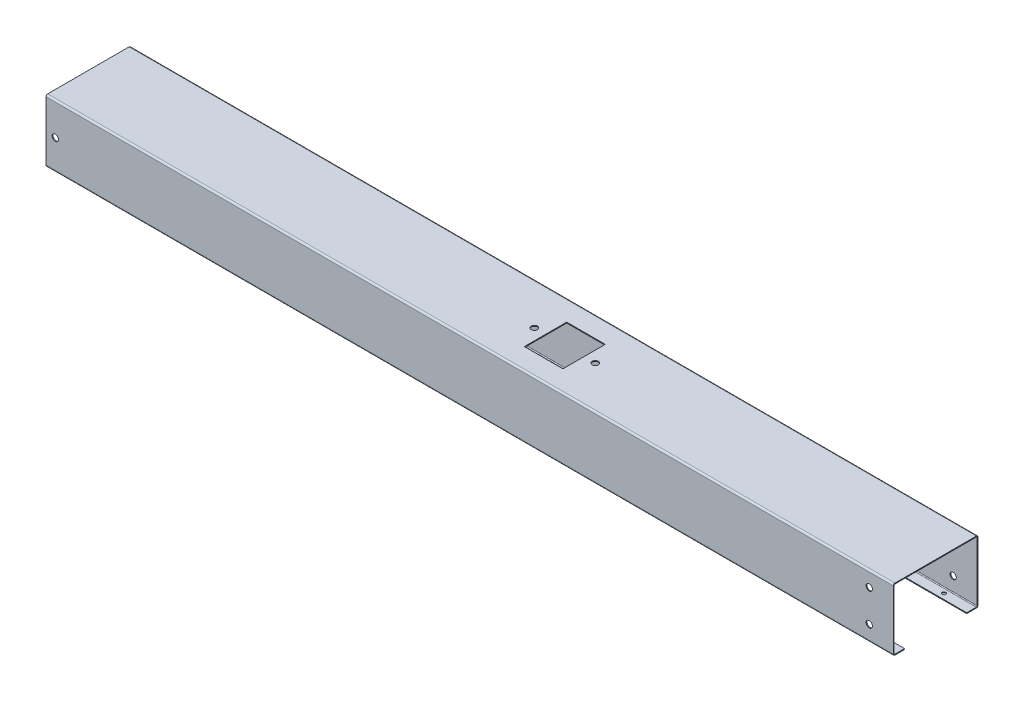
from build123d import *

# Parameters (mm, degrees)
SKETCH1_W                      = 762
SKETCH1_H                      = 76.2
BASE_FLANGE1_DEPTH             = 0.75946
CUT_EXTRUDE1_DEPTH             = 10
SKETCH7_R                      = 2.8194
CUT_EXTRUDE2_DEPTH             = 10
EDGE_FLANGE1_STRIP_W           = 4.51104
EDGE_FLANGE1_STRIP_H           = 0.75946
EDGE_FLANGE1_STRIP_CUT_DEPTH   = 762
EDGE_FLANGE1_STRIP_2_W         = 4.51104
EDGE_FLANGE1_STRIP_2_H         = 0.75946
EDGE_FLANGE1_STRIP_CUT_2_DEPTH = 762
EDGE_FLANGE1_DEPTH             = 762
EDGE_FLANGE1_BEND_DEPTH        = 762
CUT_EXTRUDE4_DEPTH             = 393.47101598
CUT_EXTRUDE4_DEPTH_BACK        = 393.47101598
SKETCH42_R                     = 2.8194
EDGE_FLANGE2_STRIP_W           = 4.51104
EDGE_FLANGE2_STRIP_H           = 0.75946
EDGE_FLANGE2_STRIP_CUT_DEPTH   = 762
EDGE_FLANGE2_STRIP_2_W         = 4.51104
EDGE_FLANGE2_STRIP_2_H         = 0.75946
EDGE_FLANGE2_STRIP_CUT_2_DEPTH = 762
EDGE_FLANGE2_DEPTH             = 762
EDGE_FLANGE2_BEND_DEPTH        = 762
CUT_EXTRUDE5_REACH             = 388.993
SKETCH49_R                     = 1.651
CUT_EXTRUDE6_DEPTH             = 393.578884814
CUT_EXTRUDE6_DEPTH_BACK        = 393.578884814
SKETCH50_R                     = 2.8194


# Sheet-metal steps are written as plain solids
with BuildPart() as part:
    # Sketch1 → Base-Flange1 (new body)
    with BuildSketch(Plane(origin=(0, 0, 0), x_dir=(1, 0, 0), z_dir=(0, 1, 0))):
        Rectangle(SKETCH1_W, SKETCH1_H)
    extrude(amount=-BASE_FLANGE1_DEPTH)

    # Sketch6 → Cut-Extrude1 (cut)
    with BuildSketch(Plane(origin=(0, 0, 0), x_dir=(1, 0, 0), z_dir=(0, 1, 0))):
        Polygon((53.7835, 19.05), (64.8335, 19.05), (64.8335, -19.05), (53.7835, -19.05), (30.1625, -19.05), (30.1625, 19.05), align=None)
    extrude(amount=-CUT_EXTRUDE1_DEPTH, mode=Mode.SUBTRACT)

    # Sketch7 → Cut-Extrude2 (cut)
    with BuildSketch(Plane(origin=(0, 0, 0), x_dir=(1, 0, 0), z_dir=(0, 1, 0))):
        with Locations(Location((20.0625, 0, 0), (0, 0, 270))):
            Circle(SKETCH7_R)
        with Locations(Location((74.9335, 0, 0), (0, 0, 270))):
            Circle(SKETCH7_R)
    extrude(amount=-CUT_EXTRUDE2_DEPTH, mode=Mode.SUBTRACT)

    # Edge-Flange1 strip (across the edge) → Edge-Flange1 strip cut (cut)
    with BuildSketch(Plane(origin=(-381, -0.75946, -38.1), x_dir=(0, 0, 1), z_dir=(1, 0, 0))):
        with Locations((-0.75946, -0.37973)):
            Rectangle(EDGE_FLANGE1_STRIP_W, EDGE_FLANGE1_STRIP_H)
    extrude(amount=EDGE_FLANGE1_STRIP_CUT_DEPTH, mode=Mode.SUBTRACT)

    # Edge-Flange1 strip 2 (across the edge) → Edge-Flange1 strip cut 2 (cut)
    with BuildSketch(Plane(origin=(381, -0.75946, 38.1), x_dir=(0, 0, -1), z_dir=(-1, 0, 0))):
        with Locations((-0.75946, -0.37973)):
            Rectangle(EDGE_FLANGE1_STRIP_2_W, EDGE_FLANGE1_STRIP_2_H)
    extrude(amount=EDGE_FLANGE1_STRIP_CUT_2_DEPTH, mode=Mode.SUBTRACT)

    # Edge-Flange1 section (across the edge) → Edge-Flange1 (add)
    with BuildSketch(Plane(origin=(-381, -0.75946, -38.1), x_dir=(0, 0, 1), z_dir=(1, 0, 0))):
        with BuildLine():
            Line((0, 0.7366), (0, 54.61254))
            Line((0, 54.61254), (0.75946, 54.61254))
            Line((0.75946, 54.61254), (0.75946, 0.7366))
            ThreePointArc((0.75946, 0.7366), (0.975205145, 0.215745145), (1.49606, 0))
            Line((1.49606, 0), (1.49606, -0.75946))
            ThreePointArc((1.49606, -0.75946), (0.438185829, -0.321274171), (0, 0.7366))
        make_face()
    extrude(amount=EDGE_FLANGE1_DEPTH)

    # Edge-Flange1 section 2 (across the edge) → Edge-Flange1 bend (add)
    with BuildSketch(Plane(origin=(381, -0.75946, 38.1), x_dir=(0, 0, -1), z_dir=(-1, 0, 0))):
        with BuildLine():
            Line((0, 0.7366), (0, 54.61254))
            Line((0, 54.61254), (0.75946, 54.61254))
            Line((0.75946, 54.61254), (0.75946, 0.7366))
            ThreePointArc((0.75946, 0.7366), (0.975205145, 0.215745145), (1.49606, 0))
            Line((1.49606, 0), (1.49606, -0.75946))
            ThreePointArc((1.49606, -0.75946), (0.438185829, -0.321274171), (0, 0.7366))
        make_face()
    extrude(amount=EDGE_FLANGE1_BEND_DEPTH)

    # Sketch42 → Cut-Extrude4 (cut, two sides: drawn at the far end of the back side and taken through both)
    with BuildSketch(Plane(origin=(0, 0, -38.1), x_dir=(-1, 0, 0), z_dir=(0, 0, -1)).offset(-CUT_EXTRUDE4_DEPTH_BACK)):
        with Locations(Location((-359.41, -13.45946, 0), (0, 0, 90))):
            Circle(SKETCH42_R)
        with Locations(Location((-359.41, -42.164, 0), (0, 0, 90))):
            Circle(SKETCH42_R)
    extrude(amount=CUT_EXTRUDE4_DEPTH + CUT_EXTRUDE4_DEPTH_BACK, mode=Mode.SUBTRACT)

    # Edge-Flange2 strip (across the edge) → Edge-Flange2 strip cut (cut)
    with BuildSketch(Plane(origin=(-381, -55.372, -37.34054), x_dir=(0, 1, 0), z_dir=(1, 0, 0))):
        with Locations((-1.51892, -0.37973)):
            Rectangle(EDGE_FLANGE2_STRIP_W, EDGE_FLANGE2_STRIP_H)
    extrude(amount=EDGE_FLANGE2_STRIP_CUT_DEPTH, mode=Mode.SUBTRACT)

    # Edge-Flange2 strip 2 (across the edge) → Edge-Flange2 strip cut 2 (cut)
    with BuildSketch(Plane(origin=(381, -55.372, 37.34054), x_dir=(0, 1, 0), z_dir=(-1, 0, 0))):
        with Locations((-1.51892, -0.37973)):
            Rectangle(EDGE_FLANGE2_STRIP_2_W, EDGE_FLANGE2_STRIP_2_H)
    extrude(amount=EDGE_FLANGE2_STRIP_CUT_2_DEPTH, mode=Mode.SUBTRACT)

    # Edge-Flange2 section (across the edge) → Edge-Flange2 (add)
    with BuildSketch(Plane(origin=(-381, -55.372, -37.34054), x_dir=(0, 1, 0), z_dir=(1, 0, 0))):
        with BuildLine():
            Line((-0.75946, 0.7366), (-0.75946, 9.40054))
            Line((-0.75946, 9.40054), (0, 9.40054))
            Line((0, 9.40054), (0, 0.7366))
            ThreePointArc((0, 0.7366), (0.215745145, 0.215745145), (0.7366, 0))
            Line((0.7366, 0), (0.7366, -0.75946))
            ThreePointArc((0.7366, -0.75946), (-0.321274171, -0.321274171), (-0.75946, 0.7366))
        make_face()
    extrude(amount=EDGE_FLANGE2_DEPTH)

    # Edge-Flange2 section 2 (across the edge) → Edge-Flange2 bend (add)
    with BuildSketch(Plane(origin=(381, -55.372, 37.34054), x_dir=(0, 1, 0), z_dir=(-1, 0, 0))):
        with BuildLine():
            Line((-0.75946, 0.7366), (-0.75946, 9.40054))
            Line((-0.75946, 9.40054), (0, 9.40054))
            Line((0, 9.40054), (0, 0.7366))
            ThreePointArc((0, 0.7366), (0.215745145, 0.215745145), (0.7366, 0))
            Line((0.7366, 0), (0.7366, -0.75946))
            ThreePointArc((0.7366, -0.75946), (-0.321274171, -0.321274171), (-0.75946, 0.7366))
        make_face()
    extrude(amount=EDGE_FLANGE2_BEND_DEPTH)

    # Sketch49 → Cut-Extrude5 (cut, up to next)
    with BuildSketch(Plane.XZ.offset(56.13146), mode=Mode.PRIVATE) as cut_extrude5_sk1:
        with Locations(Location((254, -32.79394, 0), (0, 0, 270))):
            Circle(SKETCH49_R)
    cut_extrude5_tool1 = extrude(cut_extrude5_sk1.sketch, amount=-CUT_EXTRUDE5_REACH, mode=Mode.PRIVATE) & part.part
    # Sketch49 → Cut-Extrude5 (cut, up to next)
    with BuildSketch(Plane.XZ.offset(56.13146), mode=Mode.PRIVATE) as cut_extrude5_sk2:
        with Locations(Location((254, 32.79394, 0), (0, 0, 270))):
            Circle(SKETCH49_R)
    cut_extrude5_tool2 = extrude(cut_extrude5_sk2.sketch, amount=-CUT_EXTRUDE5_REACH, mode=Mode.PRIVATE) & part.part
    # Sketch49 → Cut-Extrude5 (cut, up to next)
    with BuildSketch(Plane.XZ.offset(56.13146), mode=Mode.PRIVATE) as cut_extrude5_sk3:
        with Locations(Location((0, 32.79394, 0), (0, 0, 270))):
            Circle(SKETCH49_R)
    cut_extrude5_tool3 = extrude(cut_extrude5_sk3.sketch, amount=-CUT_EXTRUDE5_REACH, mode=Mode.PRIVATE) & part.part
    # Sketch49 → Cut-Extrude5 (cut, up to next)
    with BuildSketch(Plane.XZ.offset(56.13146), mode=Mode.PRIVATE) as cut_extrude5_sk4:
        with Locations(Location((0, -32.79394, 0), (0, 0, 270))):
            Circle(SKETCH49_R)
    cut_extrude5_tool4 = extrude(cut_extrude5_sk4.sketch, amount=-CUT_EXTRUDE5_REACH, mode=Mode.PRIVATE) & part.part
    # Sketch49 → Cut-Extrude5 (cut, up to next)
    with BuildSketch(Plane.XZ.offset(56.13146), mode=Mode.PRIVATE) as cut_extrude5_sk5:
        with Locations(Location((-304.8, -32.79394, 0), (0, 0, 270))):
            Circle(SKETCH49_R)
    cut_extrude5_tool5 = extrude(cut_extrude5_sk5.sketch, amount=-CUT_EXTRUDE5_REACH, mode=Mode.PRIVATE) & part.part
    # Sketch49 → Cut-Extrude5 (cut, up to next)
    with BuildSketch(Plane.XZ.offset(56.13146), mode=Mode.PRIVATE) as cut_extrude5_sk6:
        with Locations(Location((-304.8, 32.79394, 0), (0, 0, 270))):
            Circle(SKETCH49_R)
    cut_extrude5_tool6 = extrude(cut_extrude5_sk6.sketch, amount=-CUT_EXTRUDE5_REACH, mode=Mode.PRIVATE) & part.part
    # Sketch49 → Cut-Extrude5 (cut, up to next)
    with BuildSketch(Plane.XZ.offset(56.13146), mode=Mode.PRIVATE) as cut_extrude5_sk7:
        with Locations(Location((-355.6, 32.79394, 0), (0, 0, 270))):
            Circle(SKETCH49_R)
    cut_extrude5_tool7 = extrude(cut_extrude5_sk7.sketch, amount=-CUT_EXTRUDE5_REACH, mode=Mode.PRIVATE) & part.part
    # Sketch49 → Cut-Extrude5 (cut, up to next)
    with BuildSketch(Plane.XZ.offset(56.13146), mode=Mode.PRIVATE) as cut_extrude5_sk8:
        with Locations(Location((-355.6, -32.79394, 0), (0, 0, 270))):
            Circle(SKETCH49_R)
    cut_extrude5_tool8 = extrude(cut_extrude5_sk8.sketch, amount=-CUT_EXTRUDE5_REACH, mode=Mode.PRIVATE) & part.part
    # Sketch49 → Cut-Extrude5 (cut, up to next)
    with BuildSketch(Plane.XZ.offset(56.13146), mode=Mode.PRIVATE) as cut_extrude5_sk9:
        with Locations(Location((355.6, -32.79394, 0), (0, 0, 270))):
            Circle(SKETCH49_R)
    cut_extrude5_tool9 = extrude(cut_extrude5_sk9.sketch, amount=-CUT_EXTRUDE5_REACH, mode=Mode.PRIVATE) & part.part
    # Sketch49 → Cut-Extrude5 (cut, up to next)
    with BuildSketch(Plane.XZ.offset(56.13146), mode=Mode.PRIVATE) as cut_extrude5_sk10:
        with Locations(Location((355.6, 32.79394, 0), (0, 0, 270))):
            Circle(SKETCH49_R)
    cut_extrude5_tool10 = extrude(cut_extrude5_sk10.sketch, amount=-CUT_EXTRUDE5_REACH, mode=Mode.PRIVATE) & part.part
    # Sketch49 → Cut-Extrude5 (cut, up to next)
    with BuildSketch(Plane.XZ.offset(56.13146), mode=Mode.PRIVATE) as cut_extrude5_sk11:
        with Locations(Location((152.4, 32.79394, 0), (0, 0, 270))):
            Circle(SKETCH49_R)
    cut_extrude5_tool11 = extrude(cut_extrude5_sk11.sketch, amount=-CUT_EXTRUDE5_REACH, mode=Mode.PRIVATE) & part.part
    # Sketch49 → Cut-Extrude5 (cut, up to next)
    with BuildSketch(Plane.XZ.offset(56.13146), mode=Mode.PRIVATE) as cut_extrude5_sk12:
        with Locations(Location((152.4, -32.79394, 0), (0, 0, 270))):
            Circle(SKETCH49_R)
    cut_extrude5_tool12 = extrude(cut_extrude5_sk12.sketch, amount=-CUT_EXTRUDE5_REACH, mode=Mode.PRIVATE) & part.part
    # Sketch49 → Cut-Extrude5 (cut, up to next)
    with BuildSketch(Plane.XZ.offset(56.13146), mode=Mode.PRIVATE) as cut_extrude5_sk13:
        with Locations(Location((-152.4, 32.79394, 0), (0, 0, 270))):
            Circle(SKETCH49_R)
    cut_extrude5_tool13 = extrude(cut_extrude5_sk13.sketch, amount=-CUT_EXTRUDE5_REACH, mode=Mode.PRIVATE) & part.part
    # Sketch49 → Cut-Extrude5 (cut, up to next)
    with BuildSketch(Plane.XZ.offset(56.13146), mode=Mode.PRIVATE) as cut_extrude5_sk14:
        with Locations(Location((-152.4, -32.79394, 0), (0, 0, 270))):
            Circle(SKETCH49_R)
    cut_extrude5_tool14 = extrude(cut_extrude5_sk14.sketch, amount=-CUT_EXTRUDE5_REACH, mode=Mode.PRIVATE) & part.part
    add(cut_extrude5_tool1.solids().sort_by_distance((254, -56.13146, -32.79394))[0], mode=Mode.SUBTRACT)
    add(cut_extrude5_tool2.solids().sort_by_distance((254, -56.13146, 32.79394))[0], mode=Mode.SUBTRACT)
    add(cut_extrude5_tool3.solids().sort_by_distance((0, -56.13146, 32.79394))[0], mode=Mode.SUBTRACT)
    add(cut_extrude5_tool4.solids().sort_by_distance((0, -56.13146, -32.79394))[0], mode=Mode.SUBTRACT)
    add(cut_extrude5_tool5.solids().sort_by_distance((-304.8, -56.13146, -32.79394))[0], mode=Mode.SUBTRACT)
    add(cut_extrude5_tool6.solids().sort_by_distance((-304.8, -56.13146, 32.79394))[0], mode=Mode.SUBTRACT)
    add(cut_extrude5_tool7.solids().sort_by_distance((-355.6, -56.13146, 32.79394))[0], mode=Mode.SUBTRACT)
    add(cut_extrude5_tool8.solids().sort_by_distance((-355.6, -56.13146, -32.79394))[0], mode=Mode.SUBTRACT)
    add(cut_extrude5_tool9.solids().sort_by_distance((355.6, -56.13146, -32.79394))[0], mode=Mode.SUBTRACT)
    add(cut_extrude5_tool10.solids().sort_by_distance((355.6, -56.13146, 32.79394))[0], mode=Mode.SUBTRACT)
    add(cut_extrude5_tool11.solids().sort_by_distance((152.4, -56.13146, 32.79394))[0], mode=Mode.SUBTRACT)
    add(cut_extrude5_tool12.solids().sort_by_distance((152.4, -56.13146, -32.79394))[0], mode=Mode.SUBTRACT)
    add(cut_extrude5_tool13.solids().sort_by_distance((-152.4, -56.13146, 32.79394))[0], mode=Mode.SUBTRACT)
    add(cut_extrude5_tool14.solids().sort_by_distance((-152.4, -56.13146, -32.79394))[0], mode=Mode.SUBTRACT)

    # Sketch50 → Cut-Extrude6 (cut, two sides: drawn at the far end of the back side and taken through both)
    with BuildSketch(Plane.XY.offset(38.1).offset(-CUT_EXTRUDE6_DEPTH_BACK)):
        with Locations((-372.618, -29.21)):
            Circle(SKETCH50_R)
    extrude(amount=CUT_EXTRUDE6_DEPTH + CUT_EXTRUDE6_DEPTH_BACK, mode=Mode.SUBTRACT)


solid = part.part
